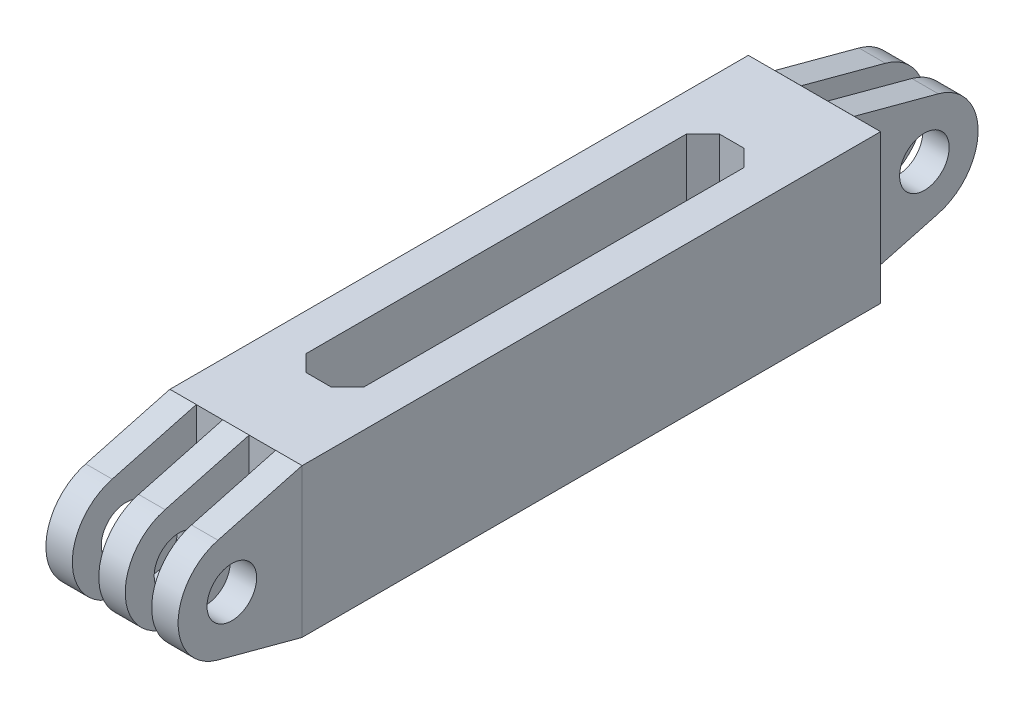
from build123d import *

# Parameters (mm, degrees)
SKETCH1_W                   = 16
SKETCH1_H                   = 70
BOSS_EXTRUDE1_DEPTH         = 18
SKETCH2_R                   = 3
BOSS_EXTRUDE2_DEPTH         = 3.2
SKETCH3_R                   = 3
BOSS_EXTRUDE3_DEPTH         = 3.2
BODY_MOVE_COPY2_START       = -1.6
BODY_MOVE_COPY2_OUTLINE_R   = 3
BODY_MOVE_COPY2_DEPTH       = 3.2
BODY_MOVE_COPY2_START_2     = 4.8
BODY_MOVE_COPY2_2_OUTLINE_R = 3
BODY_MOVE_COPY2_2_DEPTH     = 3.2
SKETCH4_R                   = 5.25
CUT_EXTRUDE1_DEPTH          = 1.75


# Read off the part's stored shape, not the designer's step: Body-Move/Copy2
with BuildPart() as part:
    # Sketch1 → Boss-Extrude1 (new body)
    with BuildSketch(Plane(origin=(0, 0, 0), x_dir=(1, 0, 0), z_dir=(0, 1, 0))):
        Rectangle(SKETCH1_W, SKETCH1_H)
        Polygon((-3.5, 23), (-1.5, 25), (1.5, 25), (3.5, 23), (3.5, -23), (1.5, -25), (-1.5, -25), (-3.5, -23), align=None, mode=Mode.SUBTRACT)
    extrude(amount=BOSS_EXTRUDE1_DEPTH)


with BuildPart() as body_2:
    # Sketch2 → Boss-Extrude2 (new body)
    with BuildSketch(Plane(origin=(4.8, 0, 0), x_dir=(0, 0, -1), z_dir=(1, 0, 0))):
        with BuildLine():
            Line((45.182323793, 2.721482129), (35, -0.006863308))
            Line((35, -0.006863308), (35, 18.006863308))
            Line((35, 18.006863308), (45.182323793, 15.278517871))
            ThreePointArc((45.182323793, 15.278517871), (50, 9), (45.182323793, 2.721482129))
        make_face()
        with Locations((43.5, 9)):
            Circle(SKETCH2_R, mode=Mode.SUBTRACT)
    extrude(amount=-BOSS_EXTRUDE2_DEPTH)


with BuildPart() as body_3:
    # Body-Move/Copy1: copy of body 2
    add(body_2.part.moved(Location((-6.4, 0, 0))))


with BuildPart() as body_4:
    # Sketch3 → Boss-Extrude3 (new body)
    with BuildSketch(Plane.ZY.offset(8)):
        with BuildLine():
            Line((45.182323793, 15.278517871), (35, 18.006863308))
            Line((35, 18.006863308), (35, -0.006863308))
            Line((35, -0.006863308), (45.182323793, 2.721482129))
            ThreePointArc((45.182323793, 2.721482129), (50, 9), (45.182323793, 15.278517871))
        make_face()
        with Locations((43.5, 9)):
            Circle(SKETCH3_R, mode=Mode.SUBTRACT)
    extrude(amount=-BOSS_EXTRUDE3_DEPTH)

    # Sketch4 → Cut-Extrude1 (cut)
    with BuildSketch(Plane(origin=(-8, 0, 0), x_dir=(0, 0, -1), z_dir=(1, 0, 0))):
        with Locations((-43.5, 9)):
            Circle(SKETCH4_R)
    extrude(amount=CUT_EXTRUDE1_DEPTH, mode=Mode.SUBTRACT)


with BuildPart() as body_5:
    # Body-Move/Copy2 outline → Body-Move/Copy2 (new body)
    with BuildSketch(Plane.YZ.offset(BODY_MOVE_COPY2_START)):
        with BuildLine():
            ThreePointArc((15.278517871, 45.182323793), (9, 50), (2.721482129, 45.182323793))
            Line((2.721482129, 45.182323793), (-0.006863308, 35))
            Line((-0.006863308, 35), (18.006863308, 35))
            Line((18.006863308, 35), (15.278517871, 45.182323793))
        make_face()
        with Locations((9, 43.5)):
            Circle(BODY_MOVE_COPY2_OUTLINE_R, mode=Mode.SUBTRACT)
    extrude(amount=BODY_MOVE_COPY2_DEPTH)


with BuildPart() as body_6:
    # Body-Move_Copy2 2 outline → Body-Move_Copy2 2 (new body)
    with BuildSketch(Plane.YZ.offset(BODY_MOVE_COPY2_START_2)):
        with BuildLine():
            ThreePointArc((15.278517871, 45.182323793), (9, 50), (2.721482129, 45.182323793))
            Line((2.721482129, 45.182323793), (-0.006863308, 35))
            Line((-0.006863308, 35), (18.006863308, 35))
            Line((18.006863308, 35), (15.278517871, 45.182323793))
        make_face()
        with Locations((9, 43.5)):
            Circle(BODY_MOVE_COPY2_2_OUTLINE_R, mode=Mode.SUBTRACT)
    extrude(amount=BODY_MOVE_COPY2_2_DEPTH)


solid = Compound([part.part, body_2.part, body_3.part, body_4.part, body_5.part, body_6.part])
